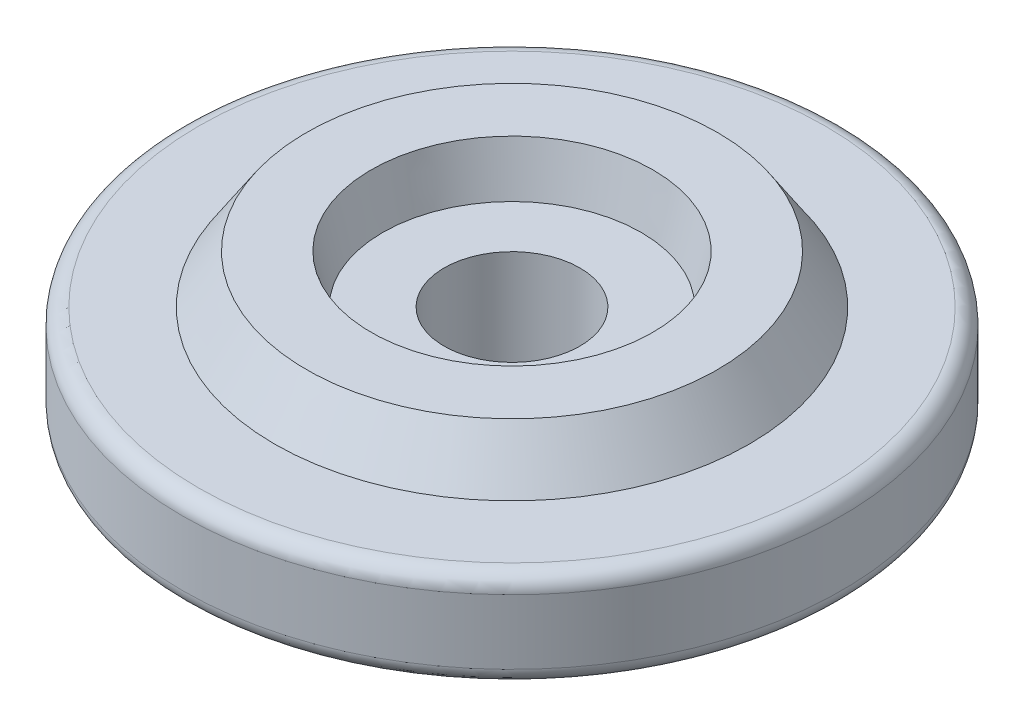
from build123d import *


with BuildPart() as part:
    # Sketch1 → Revolve1 (revolve)
    with BuildSketch(Plane.XY):
        with BuildLine():
            Line((2.1, 0), (2.1, 3))
            Line((2.1, 3), (4, 3))
            Line((4, 3), (4.359369746, 4.5))
            Line((4.359369746, 4.5), (6.359369746, 4.5))
            Line((6.359369746, 4.5), (7.347987035, 3))
            Line((7.347987035, 3), (9.7, 3))
            ThreePointArc((9.7, 3), (10.053553391, 2.853553391), (10.2, 2.5))
            Line((10.2, 2.5), (10.2, 0.5))
            ThreePointArc((10.2, 0.5), (10.053553391, 0.146446609), (9.7, 0))
            Line((9.7, 0), (2.1, 0))
        make_face()
    revolve(axis=Axis((0, 0, 0), (0, 1, 0)))


solid = part.part
